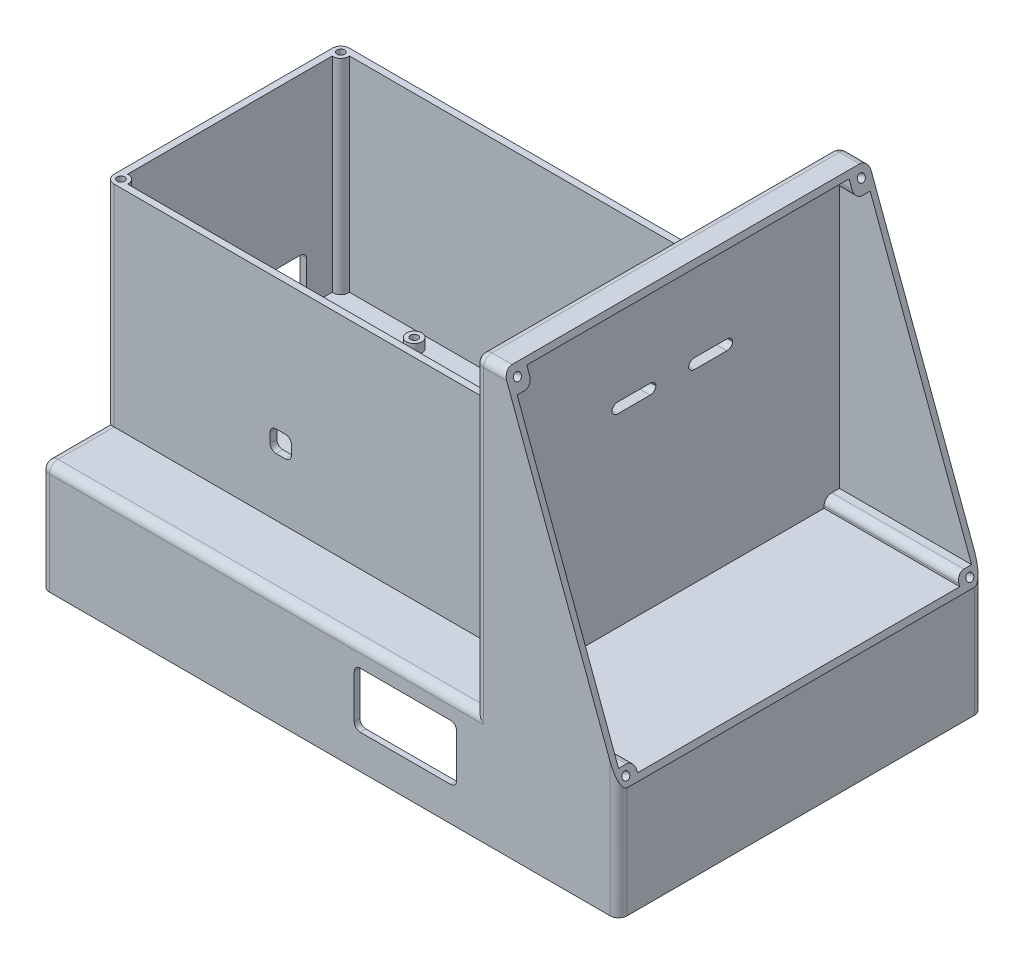
from build123d import *

# Parameters (mm, degrees)
SKETCH1_W                 = 129.286
SKETCH1_H                 = 70.104
BOSS_EXTRUDE1_DEPTH       = 1.7
SKETCH1_6_W               = 129.286
SKETCH1_6_H               = 70.104
SKETCH1_6_W_2             = 125.286
SKETCH1_6_H_2             = 66.104
BOSS_EXTRUDE2_DEPTH       = 60.96
SKETCH5_R                 = 2.286
BOSS_EXTRUDE3_DEPTH       = 62.66
SKETCH4_R                 = 2.286
BOSS_EXTRUDE4_DEPTH       = 4.572
F_4_40_TAPPED_HOLE1_D     = 2.2606
F_4_40_TAPPED_HOLE1_DEPTH = 2.192847242
F_4_40_TAPPED_HOLE1_TIP   = 0.679152758
F_4_40_TAPPED_HOLE2_D     = 2.2606
F_4_40_TAPPED_HOLE2_DEPTH = 6.940847242
F_4_40_TAPPED_HOLE2_TIP   = 0.679152758
FILLET1_R                 = 2.54
SKETCH16_W                = 9.398
SKETCH16_H                = 11.176
SKETCH16_W_2              = 20.828
SKETCH16_H_2              = 4.826
SKETCH16_W_3              = 11.938
SKETCH16_H_3              = 11.43
CUT_EXTRUDE1_DEPTH        = 2.54
SKETCH19_W                = 6.35
SKETCH19_H                = 6.35
CUT_EXTRUDE2_DEPTH        = 2.54
SKETCH17_W                = 13.208
SKETCH17_H                = 3.048
CUT_EXTRUDE3_DEPTH        = 2.54
SKETCH29_W                = 172.056
SKETCH29_H                = 108.556
BOSS_EXTRUDE8_DEPTH       = 1.7
SKETCH29_4_W              = 172.056
SKETCH29_4_H              = 108.556
SKETCH29_4_W_2            = 168.656
SKETCH29_4_H_2            = 105.156
BOSS_EXTRUDE9_DEPTH       = 33.02
SKETCH29_5_R              = 2.286
BOSS_EXTRUDE10_DEPTH      = 33.02
F_4_40_TAPPED_HOLE5_D     = 2.2606
F_4_40_TAPPED_HOLE5_DEPTH = 6.940847242
F_4_40_TAPPED_HOLE5_TIP   = 0.679152758
FILLET4_R                 = 2.54
FILLET9_R                 = 1.778
SKETCH41_W                = 55.88
SKETCH41_H                = 7.62
CUT_EXTRUDE4_DEPTH        = 2.54
FILLET10_R                = 1.778
SKETCH42_W                = 30.48
SKETCH42_H                = 16.51
CUT_EXTRUDE5_DEPTH        = 2.54
FILLET11_R                = 1.778
BOSS_EXTRUDE11_START      = 1.7
SKETCH43_W                = 105.156
SKETCH43_H                = 90.400995982
BOSS_EXTRUDE11_DEPTH      = 1.7
BOSS_EXTRUDE12_DEPTH      = 1.7
BOSS_EXTRUDE13_DEPTH      = 1.7
SKETCH48_W                = 9.153181433
SKETCH48_H                = 108.556
BOSS_EXTRUDE17_DEPTH      = 1.7
BOSS_EXTRUDE19_DEPTH      = 61.39
FILLET12_R                = 2.54
BOSS_EXTRUDE20_REACH      = 183.538
SKETCH53_W                = 96.012
SKETCH53_H                = 1.7
F_4_40_TAPPED_HOLE8_D     = 2.2606
F_4_40_TAPPED_HOLE8_DEPTH = 7.62
F_4_40_TAPPED_HOLE8_TIP   = 0.679152758


with BuildPart() as part:
    # Sketch1 → Boss-Extrude1 (new body)
    with BuildSketch(Plane(origin=(0, 0, 0), x_dir=(1, 0, 0), z_dir=(0, 1, 0))):
        with Locations((62.643, -33.052)):
            Rectangle(SKETCH1_W, SKETCH1_H)
    extrude(amount=-BOSS_EXTRUDE1_DEPTH)

    # Sketch1<6> → Boss-Extrude2 (add)
    with BuildSketch(Plane(origin=(0, 0, 0), x_dir=(1, 0, 0), z_dir=(0, 1, 0))):
        with Locations((62.643, -33.052)):
            Rectangle(SKETCH1_6_W, SKETCH1_6_H)
        with Locations((62.643, -33.052)):
            Rectangle(SKETCH1_6_W_2, SKETCH1_6_H_2, mode=Mode.SUBTRACT)
    extrude(amount=BOSS_EXTRUDE2_DEPTH)

    # Sketch5 → Boss-Extrude3 (add)
    with BuildSketch(Plane.XZ.offset(1.7)):
        with Locations((0.286, 65.818)):
            Circle(SKETCH5_R)
        with Locations((0.286, 0.286)):
            Circle(SKETCH5_R)
        with Locations((125, 65.818)):
            Circle(SKETCH5_R)
        with Locations((125, 0.286)):
            Circle(SKETCH5_R)
    extrude(amount=-BOSS_EXTRUDE3_DEPTH)

    # Sketch4 → Boss-Extrude4 (add)
    with BuildSketch(Plane.XZ.offset(1.7)):
        with Locations(Location((25.432, 50.832, 0), (0, 0, 270))):
            Circle(SKETCH4_R)
        with Locations(Location((26.702, 4.858, 0), (0, 0, 270))):
            Circle(SKETCH4_R)
        with Locations(Location((78.01, 20.352, 0), (0, 0, 270))):
            Circle(SKETCH4_R)
        with Locations(Location((105.95, 4.858, 0), (0, 0, 270))):
            Circle(SKETCH4_R)
        with Locations(Location((87.154, 45.752, 0), (0, 0, 270))):
            Circle(SKETCH4_R)
        with Locations(Location((108.49, 50.832, 0), (0, 0, 270))):
            Circle(SKETCH4_R)
    extrude(amount=-BOSS_EXTRUDE4_DEPTH)

    # #4-40 Tapped Hole1
    with Locations(Plane(origin=(0, 2.872, 0), x_dir=(1, 0, 0), z_dir=(0, 1, 0))):
        with Locations((26.702, -4.858), (78.01, -20.352), (105.95, -4.858), (87.154, -45.752), (108.49, -50.832), (25.432, -50.832)):
            Hole(F_4_40_TAPPED_HOLE1_D / 2, depth=F_4_40_TAPPED_HOLE1_DEPTH)
            with Locations((0, 0, -(F_4_40_TAPPED_HOLE1_DEPTH + F_4_40_TAPPED_HOLE1_TIP / 2))):  # 118° drill point
                Cone(0, F_4_40_TAPPED_HOLE1_D / 2, F_4_40_TAPPED_HOLE1_TIP, mode=Mode.SUBTRACT)

    # #4-40 Tapped Hole2
    with Locations(Plane(origin=(0, 60.96, 0), x_dir=(1, 0, 0), z_dir=(0, 1, 0))):
        with Locations((0.286, -0.286), (0.286, -65.796286523), (125, -65.818), (125, -0.286)):
            Hole(F_4_40_TAPPED_HOLE2_D / 2, depth=F_4_40_TAPPED_HOLE2_DEPTH)
            with Locations((0, 0, -(F_4_40_TAPPED_HOLE2_DEPTH + F_4_40_TAPPED_HOLE2_TIP / 2))):  # 118° drill point
                Cone(0, F_4_40_TAPPED_HOLE2_D / 2, F_4_40_TAPPED_HOLE2_TIP, mode=Mode.SUBTRACT)

    # Fillet1
    fillet1_edges = [part.edges().sort_by_distance(p)[0] for p in [
        (-2, 29.63, -2),
        (-2, 29.63, 68.104),
    ]]
    fillet(fillet1_edges, radius=FILLET1_R)

    # Sketch16 → Cut-Extrude1 (cut)
    with BuildSketch(Plane.ZY.offset(2)):
        with Locations((47.403, 8.46)):
            Rectangle(SKETCH16_W, SKETCH16_H)
        with Locations((53.118, 17.985)):
            Rectangle(SKETCH16_W_2, SKETCH16_H_2)
        with Locations((16.161, 8.587)):
            Rectangle(SKETCH16_W_3, SKETCH16_H_3)
    extrude(amount=-CUT_EXTRUDE1_DEPTH, mode=Mode.SUBTRACT)

    # Sketch19 → Cut-Extrude2 (cut)
    with BuildSketch(Plane.XY.offset(68.104)):
        with Locations((50.197, 18.747)):
            Rectangle(SKETCH19_W, SKETCH19_H)
    extrude(amount=-CUT_EXTRUDE2_DEPTH, mode=Mode.SUBTRACT)

    # Sketch17 → Cut-Extrude3 (cut)
    with BuildSketch(Plane(origin=(127.286, 0, 0), x_dir=(0, 0, -1), z_dir=(1, 0, 0))):
        with Locations((-18.828, 56.642)):
            Rectangle(SKETCH17_W, SKETCH17_H)
        with Locations((-41.688, 56.642)):
            Rectangle(SKETCH17_W, SKETCH17_H)
    extrude(amount=-CUT_EXTRUDE3_DEPTH, mode=Mode.SUBTRACT)

    # Sketch29 → Boss-Extrude8 (add)
    with BuildSketch(Plane.XZ.offset(1.7)):
        with Locations((84.028, 33.052)):
            Rectangle(SKETCH29_W, SKETCH29_H)
    extrude(amount=BOSS_EXTRUDE8_DEPTH)

    # Sketch29<4> → Boss-Extrude9 (add)
    with BuildSketch(Plane.XZ.offset(1.7)):
        with Locations((84.028, 33.052)):
            Rectangle(SKETCH29_4_W, SKETCH29_4_H)
        with Locations((84.028, 33.052)):
            Rectangle(SKETCH29_4_W_2, SKETCH29_4_H_2, mode=Mode.SUBTRACT)
    extrude(amount=BOSS_EXTRUDE9_DEPTH)

    # Sketch29<5> → Boss-Extrude10 (add)
    with BuildSketch(Plane.XZ.offset(1.7)):
        with Locations((0.286, 85.044)):
            Circle(SKETCH29_5_R)
        with Locations((0.286, -18.94)):
            Circle(SKETCH29_5_R)
        with Locations((167.77, -18.94)):
            Circle(SKETCH29_5_R)
        with Locations((167.77, 85.044)):
            Circle(SKETCH29_5_R)
    extrude(amount=BOSS_EXTRUDE10_DEPTH)

    # #4-40 Tapped Hole5
    with Locations(Plane(origin=(0, -34.72, 0), x_dir=(-1, 0, 0), z_dir=(0, -1, 0))):
        with Locations((-167.77, 18.94), (-167.77, -85.044), (-0.286, -85.044), (-0.286, 18.94)):
            Hole(F_4_40_TAPPED_HOLE5_D / 2, depth=F_4_40_TAPPED_HOLE5_DEPTH)
            with Locations((0, 0, -(F_4_40_TAPPED_HOLE5_DEPTH + F_4_40_TAPPED_HOLE5_TIP / 2))):  # 118° drill point
                Cone(0, F_4_40_TAPPED_HOLE5_D / 2, F_4_40_TAPPED_HOLE5_TIP, mode=Mode.SUBTRACT)

    # Fillet4
    fillet4_edges = [part.edges().sort_by_distance(p)[0] for p in [
        (-2, -1.7, -10.343),
        (-2, -1.7, 76.447),
        (-2, -18.21, -21.226),
        (-2, -18.21, 87.33),
    ]]
    fillet(fillet4_edges, radius=FILLET4_R)

    # Fillet9
    # the kernel refuses this fillet: 1.778 mm, written as the material it adds along each edge
    with BuildSketch(Plane(origin=(-2, 14.302, 10.192), x_dir=(0, 0, 1), z_dir=(1, 0, 0)), Plane(origin=(-2, 14.048, 52.102), x_dir=(0, -1, 0), z_dir=(1, 0, 0)), Plane(origin=(127.286, 58.166, 12.224), x_dir=(0, -1, 0), z_dir=(-1, 0, 0)), Plane(origin=(127.286, 58.166, 48.292), x_dir=(0, 0, -1), z_dir=(-1, 0, 0)), Plane(origin=(47.022, 21.922, 68.104), x_dir=(1, 0, 0), z_dir=(0, 0, -1)), Plane(origin=(-2, 20.398, 63.532), x_dir=(0, -1, 0), z_dir=(1, 0, 0))) as fillet9_piece_1:
        with BuildLine():
            CenterArc((FILLET9_R, FILLET9_R), FILLET9_R, 180, 90)
            Line((0, FILLET9_R), (0, 0))
            Line((0, 0), (FILLET9_R, 0))
        make_face()
    extrude(amount=2)
    with BuildSketch(Plane(origin=(-2, 2.872, 10.192), x_dir=(0, 0, 1), z_dir=(1, 0, 0)), Plane(origin=(127.286, 55.118, 12.224), x_dir=(0, 1, 0), z_dir=(-1, 0, 0)), Plane(origin=(127.286, 58.166, 25.432), x_dir=(0, -1, 0), z_dir=(-1, 0, 0)), Plane(origin=(127.286, 55.118, 25.432), x_dir=(0, 0, -1), z_dir=(-1, 0, 0)), Plane(origin=(127.286, 58.166, 35.084), x_dir=(0, 0, 1), z_dir=(-1, 0, 0)), Plane(origin=(127.286, 55.118, 35.084), x_dir=(0, 1, 0), z_dir=(-1, 0, 0)), Plane(origin=(127.286, 55.118, 48.292), x_dir=(0, 0, -1), z_dir=(-1, 0, 0)), Plane(origin=(53.372, 21.922, 68.104), x_dir=(-1, 0, 0), z_dir=(0, 0, -1)), Plane(origin=(53.372, 15.572, 68.104), x_dir=(0, 1, 0), z_dir=(0, 0, -1)), Plane(origin=(47.022, 15.572, 68.104), x_dir=(1, 0, 0), z_dir=(0, 0, -1)), Plane(origin=(-2, 15.572, 63.532), x_dir=(0, 1, 0), z_dir=(1, 0, 0)), Plane(origin=(-2, 2.872, 52.102), x_dir=(0, 1, 0), z_dir=(1, 0, 0)), Plane(origin=(-2, 15.572, 42.704), x_dir=(0, 0, 1), z_dir=(1, 0, 0)), Plane(origin=(-2, 20.398, 42.704), x_dir=(0, -1, 0), z_dir=(1, 0, 0)), Plane(origin=(-2, 14.048, 42.704), x_dir=(0, -1, 0), z_dir=(1, 0, 0)), Plane(origin=(-2, 2.872, 42.704), x_dir=(0, 0, 1), z_dir=(1, 0, 0)), Plane(origin=(-2, 2.872, 22.13), x_dir=(0, 1, 0), z_dir=(1, 0, 0)), Plane(origin=(-2, 14.302, 22.13), x_dir=(0, 0, -1), z_dir=(1, 0, 0))) as fillet9_piece_2:
        with BuildLine():
            CenterArc((FILLET9_R, -FILLET9_R), FILLET9_R, 90, 90)
            Line((0, -FILLET9_R), (0, 0))
            Line((0, 0), (FILLET9_R, 0))
        make_face()
    extrude(amount=2)

    # Sketch41 → Cut-Extrude4 (cut)
    with BuildSketch(Plane.ZY.offset(2)):
        with Locations((27.923, -20.955)):
            Rectangle(SKETCH41_W, SKETCH41_H)
    extrude(amount=-CUT_EXTRUDE4_DEPTH, mode=Mode.SUBTRACT)

    # Fillet10
    fillet10_edges = [part.edges().sort_by_distance(p)[0] for p in [
        (-1.15, -24.765, -0.017),
        (-1.15, -17.145, -0.017),
        (-1.15, -17.145, 55.863),
        (-1.15, -24.765, 55.863),
    ]]
    fillet(fillet10_edges, radius=FILLET10_R)

    # Sketch42 → Cut-Extrude5 (cut)
    with BuildSketch(Plane.XY.offset(87.33)):
        with Locations((106.556, -16.305)):
            Rectangle(SKETCH42_W, SKETCH42_H)
    extrude(amount=-CUT_EXTRUDE5_DEPTH, mode=Mode.SUBTRACT)

    # Fillet11
    fillet11_edges = [part.edges().sort_by_distance(p)[0] for p in [
        (91.316, -24.56, 86.48),
        (91.316, -8.05, 86.48),
        (121.796, -8.05, 86.48),
        (121.796, -24.56, 86.48),
    ]]
    fillet(fillet11_edges, radius=FILLET11_R)

    # Sketch43 → Boss-Extrude11 (add)
    with BuildSketch(Plane(origin=(127.286, 0, 0), x_dir=(0, 0, -1), z_dir=(1, 0, 0)).offset(BOSS_EXTRUDE11_START)):
        with Locations((-33.052, 43.500497991)):
            Rectangle(SKETCH43_W, SKETCH43_H)
        with BuildLine():
            ThreePointArc((-23.654, 55.118), (-24.817974227, 55.551958334), (-25.41376362, 56.642))
            ThreePointArc((-25.41376362, 56.642), (-24.817974227, 57.732041666), (-23.654, 58.166))
            Line((-23.654, 58.166), (-14.002, 58.166))
            ThreePointArc((-14.002, 58.166), (-12.838025773, 57.732041666), (-12.24223638, 56.642))
            ThreePointArc((-12.24223638, 56.642), (-12.838025773, 55.551958334), (-14.002, 55.118))
            Line((-14.002, 55.118), (-23.654, 55.118))
        make_face(mode=Mode.SUBTRACT)
        with BuildLine():
            ThreePointArc((-35.10223638, 56.642), (-35.698025773, 55.551958334), (-36.862, 55.118))
            Line((-36.862, 55.118), (-46.514, 55.118))
            ThreePointArc((-46.514, 55.118), (-47.677974227, 55.551958334), (-48.27376362, 56.642))
            ThreePointArc((-48.27376362, 56.642), (-47.677974227, 57.732041666), (-46.514, 58.166))
            Line((-46.514, 58.166), (-36.862, 58.166))
            ThreePointArc((-36.862, 58.166), (-35.698025773, 57.732041666), (-35.10223638, 56.642))
        make_face(mode=Mode.SUBTRACT)
    extrude(amount=-BOSS_EXTRUDE11_DEPTH)

    # Sketch44 → Boss-Extrude12 (add)
    with BuildSketch(Plane(origin=(0, 0, -19.526), x_dir=(-1, 0, 0), z_dir=(0, 0, -1))):
        Polygon((-136.439181461, 88.700995907), (-170.056, -1.7), (-127.286, -1.7), (-127.286, 88.700995907), align=None)
    extrude(amount=BOSS_EXTRUDE12_DEPTH)

    # Sketch45 → Boss-Extrude13 (add)
    with BuildSketch(Plane.XY.offset(85.63)):
        Polygon((127.286, 88.700995982), (136.439181433, 88.700995982), (170.056, -1.7), (127.286, -1.7), align=None)
    extrude(amount=BOSS_EXTRUDE13_DEPTH)



with BuildPart() as body_2:
    # Sketch48 → Boss-Extrude17 (new body)
    with BuildSketch(Plane(origin=(0, 88.700995982, 0), x_dir=(1, 0, 0), z_dir=(0, 1, 0))):
        with Locations((131.862590716, -33.052)):
            Rectangle(SKETCH48_W, SKETCH48_H)
    extrude(amount=BOSS_EXTRUDE17_DEPTH)


with BuildPart() as part_1:
    add(part.part)

    add(body_2.part)  # Boss-Extrude19 merges body 2
    # Sketch50 → Boss-Extrude19 (add)
    with BuildSketch(Plane(origin=(128.986, 0, 0), x_dir=(0, 0, -1), z_dir=(1, 0, 0))):
        with BuildLine():
            ThreePointArc((-85.63, 0.585999992), (-84.960446105, 2.202446099), (-83.344, 2.872))
            Line((-83.344, 2.872), (-85.63, 2.872))
            Line((-85.63, 2.872), (-85.63, 0.585999992))
        make_face()
        with BuildLine():
            ThreePointArc((-81.058, 0.586), (-81.727553898, 2.202446102), (-83.344, 2.872))
            ThreePointArc((-83.344, 2.872), (-84.960446105, 2.202446099), (-85.63, 0.585999992))
            ThreePointArc((-85.63, 0.585999992), (-84.960446099, -1.030446105), (-83.344, -1.7))
            ThreePointArc((-83.344, -1.7), (-81.727553898, -1.030446102), (-81.058, 0.586))
        make_face()
        with BuildLine():
            Line((-81.058, -1.7), (-81.058, 0.586))
            ThreePointArc((-81.058, 0.586), (-81.727553898, -1.030446102), (-83.344, -1.7))
            Line((-83.344, -1.7), (-81.058, -1.7))
        make_face()
        with BuildLine():
            ThreePointArc((-83.344, -1.7), (-84.960446099, -1.030446105), (-85.63, 0.585999992))
            Line((-85.63, 0.585999992), (-85.63, -1.7))
            Line((-85.63, -1.7), (-83.344, -1.7))
        make_face()
        with BuildLine():
            Line((-85.63, 86.414995982), (-85.63, 84.128995982))
            Line((-85.63, 84.128995982), (-83.344, 84.128995982))
            ThreePointArc((-83.344, 84.128995982), (-84.960446102, 84.79854988), (-85.63, 86.414995982))
        make_face()
        with BuildLine():
            ThreePointArc((-85.63, 86.414995982), (-84.960446102, 84.79854988), (-83.344, 84.128995982))
            ThreePointArc((-83.344, 84.128995982), (-81.727553898, 84.79854988), (-81.058, 86.414995982))
            ThreePointArc((-81.058, 86.414995982), (-81.727553898, 88.031442084), (-83.344, 88.700995982))
            ThreePointArc((-83.344, 88.700995982), (-84.960446102, 88.031442084), (-85.63, 86.414995982))
        make_face()
        with BuildLine():
            Line((-85.63, 88.700995982), (-85.63, 86.414995982))
            ThreePointArc((-85.63, 86.414995982), (-84.960446102, 88.031442084), (-83.344, 88.700995982))
            Line((-83.344, 88.700995982), (-85.63, 88.700995982))
        make_face()
        with BuildLine():
            Line((14.954, 0.586), (14.954, -1.7))
            Line((14.954, -1.7), (17.240000009, -1.7))
            ThreePointArc((17.240000009, -1.7), (15.623553901, -1.030446105), (14.954, 0.586))
        make_face()
        with BuildLine():
            ThreePointArc((-83.344, 88.700995982), (-81.727553898, 88.031442084), (-81.058, 86.414995982))
            Line((-81.058, 86.414995982), (-81.058, 88.700995982))
            Line((-81.058, 88.700995982), (-83.344, 88.700995982))
        make_face()
        with BuildLine():
            ThreePointArc((17.24, 2.872), (15.623553898, 2.202446102), (14.954, 0.586))
            ThreePointArc((14.954, 0.586), (15.623553901, -1.030446105), (17.240000009, -1.7))
            ThreePointArc((17.240000009, -1.7), (18.856446105, -1.030446099), (19.526, 0.586))
            ThreePointArc((19.526, 0.586), (18.856446102, 2.202446102), (17.24, 2.872))
        make_face()
        with BuildLine():
            ThreePointArc((19.526, 0.586), (18.856446105, -1.030446099), (17.240000009, -1.7))
            Line((17.240000009, -1.7), (19.526, -1.7))
            Line((19.526, -1.7), (19.526, 0.586))
        make_face()
        with BuildLine():
            Line((19.526, 2.872), (17.24, 2.872))
            ThreePointArc((17.24, 2.872), (18.856446102, 2.202446102), (19.526, 0.586))
            Line((19.526, 0.586), (19.526, 2.872))
        make_face()
        with BuildLine():
            Line((17.24, 88.700995982), (14.954, 88.700995982))
            Line((14.954, 88.700995982), (14.954, 86.414995982))
            ThreePointArc((14.954, 86.414995982), (15.623553898, 88.031442084), (17.24, 88.700995982))
        make_face()
        with BuildLine():
            ThreePointArc((17.24, 88.700995982), (15.623553898, 88.031442084), (14.954, 86.414995982))
            ThreePointArc((14.954, 86.414995982), (15.623553898, 84.79854988), (17.24, 84.128995982))
            ThreePointArc((17.24, 84.128995982), (18.856446102, 84.79854988), (19.526, 86.414995982))
            ThreePointArc((19.526, 86.414995982), (18.856446102, 88.031442084), (17.24, 88.700995982))
        make_face()
        with BuildLine():
            Line((19.526, 88.700995907), (17.24, 88.700995982))
            ThreePointArc((17.24, 88.700995982), (18.856446102, 88.031442084), (19.526, 86.414995982))
            Line((19.526, 86.414995982), (19.526, 88.700995907))
        make_face()
        with BuildLine():
            Line((17.24, 84.128995982), (19.526, 84.128995982))
            Line((19.526, 84.128995982), (19.526, 86.414995982))
            ThreePointArc((19.526, 86.414995982), (18.856446102, 84.79854988), (17.24, 84.128995982))
        make_face()
    extrude(amount=BOSS_EXTRUDE19_DEPTH)

    # SurfaceCut6
    split(bisect_by=Plane(origin=(148.841656429, 55.348759214, 0), x_dir=(0, 0, -1), z_dir=(0.9372921867257068, 0.3485446265586991, 0)), keep=Keep.BOTTOM)

    # Fillet12
    # the kernel refuses this fillet: 2.54 mm, written as the material it takes off along each edge
    with BuildSketch(Plane(origin=(0.54, -4.24, -18.686), x_dir=(0, 1, 0), z_dir=(0, 0, -1))) as fillet12_piece_1_section:
        Polygon((0, 0), (FILLET12_R * 1.02, 0), (FILLET12_R * 1.02, -FILLET12_R * 1.02), (0, -FILLET12_R * 1.02), align=None)
    fillet12_piece_1 = extrude(amount=FILLET12_R * 1.02, mode=Mode.PRIVATE)
    fillet12_piece_1 = fillet12_piece_1 - Plane(origin=(0.54, -4.24, -18.686), x_dir=(0.7071067811865475, -0.7071067811865475, 0), z_dir=(0, 0, -1)) * Sphere(FILLET12_R, mode=Mode.PRIVATE)
    add(fillet12_piece_1, mode=Mode.SUBTRACT)
    with BuildSketch(Plane(origin=(0.54, -4.24, 84.79), x_dir=(0, 1, 0), z_dir=(0, 0, 1))) as fillet12_piece_2_section:
        Polygon((0, 0), (FILLET12_R * 1.02, 0), (FILLET12_R * 1.02, FILLET12_R * 1.02), (0, FILLET12_R * 1.02), align=None)
    fillet12_piece_2 = extrude(amount=FILLET12_R * 1.02, mode=Mode.PRIVATE)
    fillet12_piece_2 = fillet12_piece_2 - Plane(origin=(0.54, -4.24, 84.79), x_dir=(0.7071067811865475, -0.7071067811865475, 0), z_dir=(0, 0, 1)) * Sphere(FILLET12_R, mode=Mode.PRIVATE)
    add(fillet12_piece_2, mode=Mode.SUBTRACT)
    with BuildSketch(Plane(origin=(129.826, 87.860995982, -18.686), x_dir=(0, 0, -1), z_dir=(-1, 0, 0))) as fillet12_piece_3_section:
        Polygon((0, 0), (FILLET12_R * 1.02, 0), (FILLET12_R * 1.02, -FILLET12_R * 1.02), (0, -FILLET12_R * 1.02), align=None)
    fillet12_piece_3 = extrude(amount=FILLET12_R * 1.02, mode=Mode.PRIVATE)
    fillet12_piece_3 = fillet12_piece_3 - Plane(origin=(129.826, 87.860995982, -18.686), x_dir=(0, -0.7071067811865475, 0.7071067811865475), z_dir=(-1, 0, 0)) * Sphere(FILLET12_R, mode=Mode.PRIVATE)
    add(fillet12_piece_3, mode=Mode.SUBTRACT)
    with BuildSketch(Plane(origin=(129.826, 87.860995982, 84.79), x_dir=(-1, 0, 0), z_dir=(0, 0, 1))) as fillet12_piece_4_section:
        Polygon((0, 0), (FILLET12_R * 1.02, 0), (FILLET12_R * 1.02, -FILLET12_R * 1.02), (0, -FILLET12_R * 1.02), align=None)
    fillet12_piece_4 = extrude(amount=FILLET12_R * 1.02, mode=Mode.PRIVATE)
    fillet12_piece_4 = fillet12_piece_4 - Plane(origin=(129.826, 87.860995982, 84.79), x_dir=(0.7071067811865475, -0.7071067811865475, 0), z_dir=(0, 0, 1)) * Sphere(FILLET12_R, mode=Mode.PRIVATE)
    add(fillet12_piece_4, mode=Mode.SUBTRACT)
    with BuildSketch(Plane(origin=(170.056, -49.96, 87.33), x_dir=(-1, 0, 0), z_dir=(0, 1, 0)), Plane(origin=(170.056, -49.96, -21.226), x_dir=(0, 0, 1), z_dir=(0, 1, 0))) as fillet12_piece_5:
        with BuildLine():
            CenterArc((FILLET12_R, -FILLET12_R), FILLET12_R, 90, 90)
            Line((0, -FILLET12_R), (-FILLET12_R * 0.02, -FILLET12_R))
            Line((-FILLET12_R * 0.02, -FILLET12_R), (-FILLET12_R * 0.02, FILLET12_R * 0.02))
            Line((-FILLET12_R * 0.02, FILLET12_R * 0.02), (FILLET12_R, FILLET12_R * 0.02))
            Line((FILLET12_R, FILLET12_R * 0.02), (FILLET12_R, 0))
        make_face()
    extrude(amount=63.5, mode=Mode.SUBTRACT)
    with BuildSketch(Plane(origin=(127.286, -1.7, 87.33), x_dir=(0, -1, 0), z_dir=(-1, 0, 0))) as fillet12_piece_6:
        with BuildLine():
            CenterArc((FILLET12_R, -FILLET12_R), FILLET12_R, 90, 90)
            Line((0, -FILLET12_R), (-FILLET12_R * 0.02, -FILLET12_R))
            Line((-FILLET12_R * 0.02, -FILLET12_R), (-FILLET12_R * 0.02, FILLET12_R * 0.02))
            Line((-FILLET12_R * 0.02, FILLET12_R * 0.02), (FILLET12_R, FILLET12_R * 0.02))
            Line((FILLET12_R, FILLET12_R * 0.02), (FILLET12_R, 0))
        make_face()
    extrude(amount=126.746, mode=Mode.SUBTRACT)
    with BuildSketch(Plane(origin=(127.286, -1.7, -21.226), x_dir=(0, -1, 0), z_dir=(-1, 0, 0))) as fillet12_piece_7:
        with BuildLine():
            CenterArc((FILLET12_R, FILLET12_R), FILLET12_R, 180, 90)
            Line((0, FILLET12_R), (-FILLET12_R * 0.02, FILLET12_R))
            Line((-FILLET12_R * 0.02, FILLET12_R), (-FILLET12_R * 0.02, -FILLET12_R * 0.02))
            Line((-FILLET12_R * 0.02, -FILLET12_R * 0.02), (FILLET12_R, -FILLET12_R * 0.02))
            Line((FILLET12_R, -FILLET12_R * 0.02), (FILLET12_R, 0))
        make_face()
    extrude(amount=126.746, mode=Mode.SUBTRACT)
    with BuildSketch(Plane(origin=(127.286, 87.860995982, -21.226), x_dir=(0, 0, 1), z_dir=(0, -1, 0)), Plane(origin=(127.286, 87.860995982, 87.33), x_dir=(1, 0, 0), z_dir=(0, -1, 0))) as fillet12_piece_8:
        with BuildLine():
            CenterArc((FILLET12_R, -FILLET12_R), FILLET12_R, 90, 90)
            Line((0, -FILLET12_R), (-FILLET12_R * 0.02, -FILLET12_R))
            Line((-FILLET12_R * 0.02, -FILLET12_R), (-FILLET12_R * 0.02, FILLET12_R * 0.02))
            Line((-FILLET12_R * 0.02, FILLET12_R * 0.02), (FILLET12_R, FILLET12_R * 0.02))
            Line((FILLET12_R, FILLET12_R * 0.02), (FILLET12_R, 0))
        make_face()
    extrude(amount=89.560995982, mode=Mode.SUBTRACT)
    with BuildSketch(Plane(origin=(127.286, 90.400995982, 84.79), x_dir=(0, -1, 0), z_dir=(0, 0, -1))) as fillet12_piece_9:
        with BuildLine():
            CenterArc((FILLET12_R, -FILLET12_R), FILLET12_R, 90, 90)
            Line((0, -FILLET12_R), (-FILLET12_R * 0.02, -FILLET12_R))
            Line((-FILLET12_R * 0.02, -FILLET12_R), (-FILLET12_R * 0.02, FILLET12_R * 0.02))
            Line((-FILLET12_R * 0.02, FILLET12_R * 0.02), (FILLET12_R, FILLET12_R * 0.02))
            Line((FILLET12_R, FILLET12_R * 0.02), (FILLET12_R, 0))
        make_face()
    extrude(amount=103.476, mode=Mode.SUBTRACT)
    with BuildSketch(Plane(origin=(151.047013713, 90.400995982, 87.33), x_dir=(0, -1, 0), z_dir=(-1, 0, 0))) as fillet12_piece_10:
        with BuildLine():
            CenterArc((FILLET12_R, -FILLET12_R), FILLET12_R, 90, 90)
            Line((0, -FILLET12_R), (-FILLET12_R * 0.02, -FILLET12_R))
            Line((-FILLET12_R * 0.02, -FILLET12_R), (-FILLET12_R * 0.02, FILLET12_R * 0.02))
            Line((-FILLET12_R * 0.02, FILLET12_R * 0.02), (FILLET12_R, FILLET12_R * 0.02))
            Line((FILLET12_R, FILLET12_R * 0.02), (FILLET12_R, 0))
        make_face()
    extrude(amount=21.221013713, mode=Mode.SUBTRACT)
    with BuildSketch(Plane(origin=(129.826, 90.400995982, -21.226), x_dir=(0, 0, 1), z_dir=(1, 0, 0))) as fillet12_piece_11:
        with BuildLine():
            CenterArc((FILLET12_R, FILLET12_R), FILLET12_R, 180, 90)
            Line((0, FILLET12_R), (-FILLET12_R * 0.02, FILLET12_R))
            Line((-FILLET12_R * 0.02, FILLET12_R), (-FILLET12_R * 0.02, -FILLET12_R * 0.02))
            Line((-FILLET12_R * 0.02, -FILLET12_R * 0.02), (FILLET12_R, -FILLET12_R * 0.02))
            Line((FILLET12_R, -FILLET12_R * 0.02), (FILLET12_R, 0))
        make_face()
    extrude(amount=21.221013713, mode=Mode.SUBTRACT)
    with BuildSketch(Plane(origin=(142.526, -1.7, 87.33), x_dir=(0, -1, 0), z_dir=(-1, 0, 0))) as fillet12_piece_12a_section:
        with BuildLine():
            CenterArc((FILLET12_R, -FILLET12_R), FILLET12_R, 90, 90)
            Line((0, -FILLET12_R), (-FILLET12_R * 0.02, -FILLET12_R))
            Line((-FILLET12_R * 0.02, -FILLET12_R), (-FILLET12_R * 0.02, FILLET12_R * 0.02))
            Line((-FILLET12_R * 0.02, FILLET12_R * 0.02), (FILLET12_R, FILLET12_R * 0.02))
            Line((FILLET12_R, FILLET12_R * 0.02), (FILLET12_R, 0))
        make_face()
    fillet12_piece_12a = extrude(amount=141.986, mode=Mode.PRIVATE)
    fillet12_piece_12a = split(fillet12_piece_12a, bisect_by=Plane(origin=(127.286, -2.27504359, 86.75495641), z_dir=(1, 0, 0)), keep=Keep.TOP, mode=Mode.PRIVATE)
    with BuildSketch(Plane(origin=(127.286, 87.860995982, 87.33), x_dir=(1, 0, 0), z_dir=(0, -1, 0))) as fillet12_piece_12b_section:
        with BuildLine():
            CenterArc((FILLET12_R, -FILLET12_R), FILLET12_R, 90, 90)
            Line((0, -FILLET12_R), (-FILLET12_R * 0.02, -FILLET12_R))
            Line((-FILLET12_R * 0.02, -FILLET12_R), (-FILLET12_R * 0.02, FILLET12_R * 0.02))
            Line((-FILLET12_R * 0.02, FILLET12_R * 0.02), (FILLET12_R, FILLET12_R * 0.02))
            Line((FILLET12_R, FILLET12_R * 0.02), (FILLET12_R, 0))
        make_face()
    fillet12_piece_12b = extrude(amount=104.800995982, mode=Mode.PRIVATE)
    fillet12_piece_12b = split(fillet12_piece_12b, bisect_by=Plane(origin=(127.86104359, -1.7, 86.75495641), z_dir=(0, -1, 0)), keep=Keep.TOP, mode=Mode.PRIVATE)
    fillet12_piece_12 = fillet12_piece_12a & fillet12_piece_12b
    add(fillet12_piece_12, mode=Mode.SUBTRACT)
    with BuildSketch(Plane(origin=(127.286, 87.860995982, -21.226), x_dir=(0, 0, 1), z_dir=(0, -1, 0))) as fillet12_piece_13a_section:
        with BuildLine():
            CenterArc((FILLET12_R, -FILLET12_R), FILLET12_R, 90, 90)
            Line((0, -FILLET12_R), (-FILLET12_R * 0.02, -FILLET12_R))
            Line((-FILLET12_R * 0.02, -FILLET12_R), (-FILLET12_R * 0.02, FILLET12_R * 0.02))
            Line((-FILLET12_R * 0.02, FILLET12_R * 0.02), (FILLET12_R, FILLET12_R * 0.02))
            Line((FILLET12_R, FILLET12_R * 0.02), (FILLET12_R, 0))
        make_face()
    fillet12_piece_13a = extrude(amount=104.800995982, mode=Mode.PRIVATE)
    fillet12_piece_13a = split(fillet12_piece_13a, bisect_by=Plane(origin=(127.86104359, -1.7, -20.65095641), z_dir=(0, -1, 0)), keep=Keep.TOP, mode=Mode.PRIVATE)
    with BuildSketch(Plane(origin=(142.526, -1.7, -21.226), x_dir=(0, -1, 0), z_dir=(-1, 0, 0))) as fillet12_piece_13b_section:
        with BuildLine():
            CenterArc((FILLET12_R, FILLET12_R), FILLET12_R, 180, 90)
            Line((0, FILLET12_R), (-FILLET12_R * 0.02, FILLET12_R))
            Line((-FILLET12_R * 0.02, FILLET12_R), (-FILLET12_R * 0.02, -FILLET12_R * 0.02))
            Line((-FILLET12_R * 0.02, -FILLET12_R * 0.02), (FILLET12_R, -FILLET12_R * 0.02))
            Line((FILLET12_R, -FILLET12_R * 0.02), (FILLET12_R, 0))
        make_face()
    fillet12_piece_13b = extrude(amount=141.986, mode=Mode.PRIVATE)
    fillet12_piece_13b = split(fillet12_piece_13b, bisect_by=Plane(origin=(127.286, -2.27504359, -20.65095641), z_dir=(1, 0, 0)), keep=Keep.TOP, mode=Mode.PRIVATE)
    fillet12_piece_13 = fillet12_piece_13a & fillet12_piece_13b
    add(fillet12_piece_13, mode=Mode.SUBTRACT)

    # Boss-Extrude20: up to this plane
    boss_extrude20_end = Plane(origin=(136.439181461, 88.700995907, -21.226), z_dir=(-0.9372921867257067, -0.3485446265586991, 0))
    # Sketch53 → Boss-Extrude20 (add, up to the surface)
    with BuildSketch(Plane(origin=(128.986, 0, 0), x_dir=(0, 0, -1), z_dir=(1, 0, 0)), mode=Mode.PRIVATE) as boss_extrude20_sk1:
        with Locations((-33.052, -0.85)):
            Rectangle(SKETCH53_W, SKETCH53_H)
    boss_extrude20_tool1 = split(extrude(boss_extrude20_sk1.sketch, amount=BOSS_EXTRUDE20_REACH, mode=Mode.PRIVATE), bisect_by=boss_extrude20_end, keep=Keep.BOTH, mode=Mode.PRIVATE)
    add(boss_extrude20_tool1.solids().sort_by_distance((128.986, -0.85, 33.052))[0])

    # #4-40 Tapped Hole8
    with Locations(Plane(origin=(148.841656429, 55.348759214, 0), x_dir=(0, 0, -1), z_dir=(0.9372921867257067, 0.3485446265586991, 0))):
        with Locations((-84.282, 34.349342328), (18.178, 34.349342328), (18.178, -58.325501731), (-84.282, -58.325501731)):
            Hole(F_4_40_TAPPED_HOLE8_D / 2, depth=F_4_40_TAPPED_HOLE8_DEPTH)
            with Locations((0, 0, -(F_4_40_TAPPED_HOLE8_DEPTH + F_4_40_TAPPED_HOLE8_TIP / 2))):  # 118° drill point
                Cone(0, F_4_40_TAPPED_HOLE8_D / 2, F_4_40_TAPPED_HOLE8_TIP, mode=Mode.SUBTRACT)


solid = part_1.part
